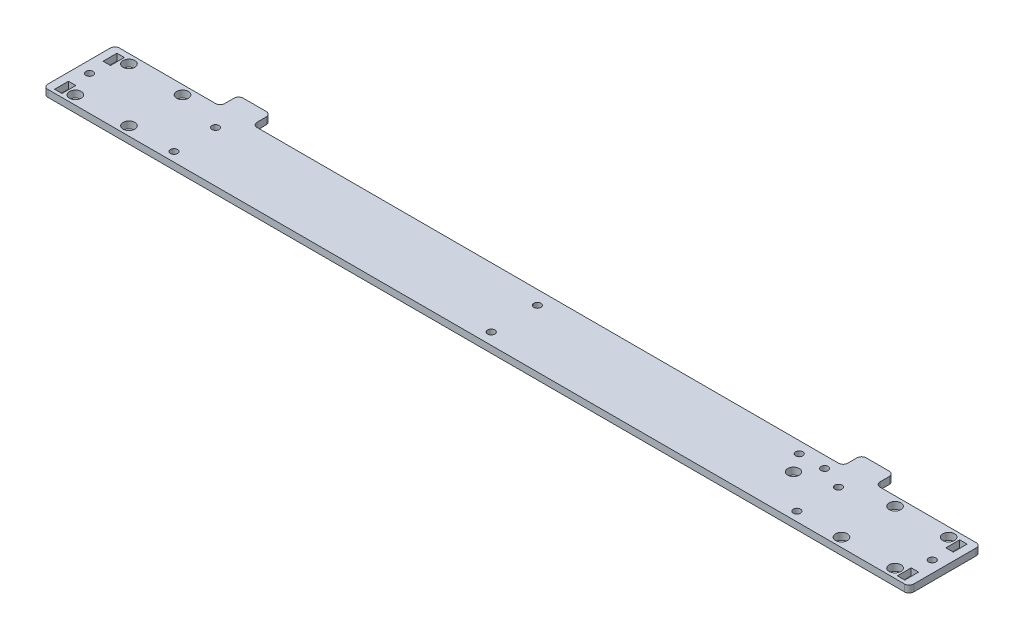
from build123d import *

# Parameters (mm, degrees)
CROQUIS1_R              = 1.55
CROQUIS1_R_2            = 2.55
CROQUIS1_R_3            = 2.5
CROQUIS1_W              = 3.2
CROQUIS1_H              = 6
SALIENTE_EXTRUIR1_DEPTH = 3
REDONDEO2_R             = 2


with BuildPart() as part:
    # Croquis1 → Saliente-Extruir1 (new body)
    with BuildSketch(Plane(origin=(0, 0, 0), x_dir=(1, 0, 0), z_dir=(0, 1, 0))):
        Polygon((0, 0), (375, 0), (375, 31), (329.4, 31), (329.4, 39), (315.4, 39), (315.4, 31), (59.6, 31), (59.6, 39), (45.6, 39), (45.6, 31), (0, 31), align=None)
        with Locations((5, 15)):
            Circle(CROQUIS1_R, mode=Mode.SUBTRACT)
        with Locations((370, 15)):
            Circle(CROQUIS1_R, mode=Mode.SUBTRACT)
        with Locations((10, 27.1)):
            Circle(CROQUIS1_R_2, mode=Mode.SUBTRACT)
        with Locations((33.2, 27.1)):
            Circle(CROQUIS1_R_2, mode=Mode.SUBTRACT)
        with Locations((33.2, 3.9)):
            Circle(CROQUIS1_R_2, mode=Mode.SUBTRACT)
        with Locations((10, 3.9)):
            Circle(CROQUIS1_R_2, mode=Mode.SUBTRACT)
        with Locations((365, 3.9)):
            Circle(CROQUIS1_R_2, mode=Mode.SUBTRACT)
        with Locations((341.8, 3.9)):
            Circle(CROQUIS1_R_2, mode=Mode.SUBTRACT)
        with Locations((365, 27.1)):
            Circle(CROQUIS1_R_2, mode=Mode.SUBTRACT)
        with Locations((341.8, 27.1)):
            Circle(CROQUIS1_R_2, mode=Mode.SUBTRACT)
        with Locations((189, 25)):
            Circle(CROQUIS1_R, mode=Mode.SUBTRACT)
        with Locations((189, 5)):
            Circle(CROQUIS1_R, mode=Mode.SUBTRACT)
        with Locations((52.6, 22)):
            Circle(CROQUIS1_R, mode=Mode.SUBTRACT)
        with Locations((52.6, 4)):
            Circle(CROQUIS1_R, mode=Mode.SUBTRACT)
        with Locations((322.4, 22)):
            Circle(CROQUIS1_R, mode=Mode.SUBTRACT)
        with Locations((322.4, 4)):
            Circle(CROQUIS1_R, mode=Mode.SUBTRACT)
        with Locations((312.4, 26)):
            Circle(CROQUIS1_R, mode=Mode.SUBTRACT)
        with Locations((301.4, 26)):
            Circle(CROQUIS1_R, mode=Mode.SUBTRACT)
        with Locations((306.9, 18)):
            Circle(CROQUIS1_R_3, mode=Mode.SUBTRACT)
        with Locations((370, 4.5)):
            Rectangle(CROQUIS1_W, CROQUIS1_H, mode=Mode.SUBTRACT)
        with Locations((5, 25.5)):
            Rectangle(CROQUIS1_W, CROQUIS1_H, mode=Mode.SUBTRACT)
        with Locations((5, 4.5)):
            Rectangle(CROQUIS1_W, CROQUIS1_H, mode=Mode.SUBTRACT)
        with Locations((370, 25.5)):
            Rectangle(CROQUIS1_W, CROQUIS1_H, mode=Mode.SUBTRACT)
    extrude(amount=SALIENTE_EXTRUIR1_DEPTH)

    # Redondeo2
    redondeo2_edges = [part.edges().sort_by_distance(p)[0] for p in [
        (375, 1.5, 0),
        (375, 1.5, -31),
        (329.4, 1.5, -31),
        (329.4, 1.5, -39),
        (315.4, 1.5, -39),
        (315.4, 1.5, -31),
        (59.6, 1.5, -31),
        (59.6, 1.5, -39),
        (0, 1.5, 0),
        (45.6, 1.5, -39),
        (45.6, 1.5, -31),
        (0, 1.5, -31),
    ]]
    fillet(redondeo2_edges, radius=REDONDEO2_R)


solid = part.part
